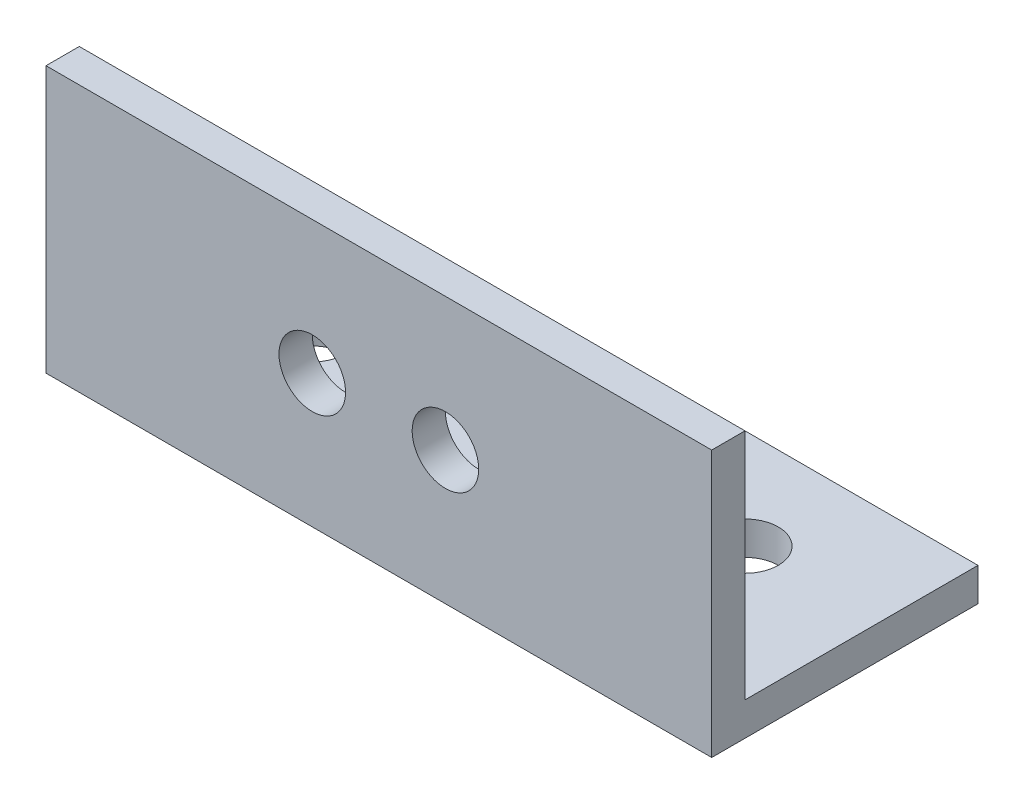
from build123d import *

# Parameters (mm, degrees)
SKETCH1_W           = 63.5
SKETCH1_H           = 25.4
BOSS_EXTRUDE1_DEPTH = 3.175
SKETCH2_W           = 63.5
SKETCH2_H           = 3.175
BOSS_EXTRUDE2_DEPTH = 22.225
SKETCH3_R           = 3.175
CUT_EXTRUDE1_DEPTH  = 3.175
SKETCH4_R           = 3.175
CUT_EXTRUDE2_DEPTH  = 3.175


with BuildPart() as part:
    # Sketch1 → Boss-Extrude1 (new body)
    with BuildSketch(Plane(origin=(0, 0, 0), x_dir=(1, 0, 0), z_dir=(0, 1, 0))):
        Rectangle(SKETCH1_W, SKETCH1_H)
    extrude(amount=BOSS_EXTRUDE1_DEPTH)

    # Sketch2 → Boss-Extrude2 (add)
    with BuildSketch(Plane(origin=(0, 3.175, 0), x_dir=(1, 0, 0), z_dir=(0, 1, 0))):
        with Locations((0, -11.1125)):
            Rectangle(SKETCH2_W, SKETCH2_H)
    extrude(amount=BOSS_EXTRUDE2_DEPTH)

    # Sketch3 → Cut-Extrude1 (cut)
    with BuildSketch(Plane(origin=(0, 0, 9.525), x_dir=(-1, 0, 0), z_dir=(0, 0, -1))):
        with Locations((6.35, 12.7)):
            Circle(SKETCH3_R)
        with Locations((-6.35, 12.7)):
            Circle(SKETCH3_R)
    extrude(amount=-CUT_EXTRUDE1_DEPTH, mode=Mode.SUBTRACT)

    # Sketch4 → Cut-Extrude2 (cut)
    with BuildSketch(Plane(origin=(0, 3.175, 0), x_dir=(1, 0, 0), z_dir=(0, 1, 0))):
        with Locations((-19.05, 0)):
            Circle(SKETCH4_R)
        with Locations((19.05, 3.175)):
            Circle(SKETCH4_R)
    extrude(amount=-CUT_EXTRUDE2_DEPTH, mode=Mode.SUBTRACT)


solid = part.part
